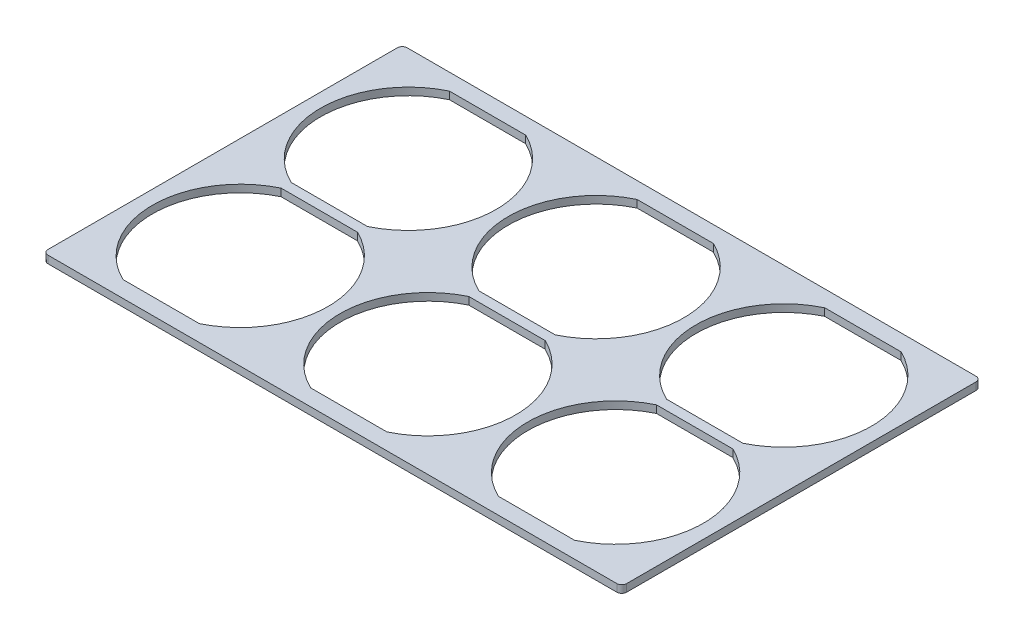
from build123d import *

# Parameters (mm, degrees)
BOSS_EXTRUDE1_DEPTH = 4.7752


with BuildPart() as part:
    # Sketch1 → Boss-Extrude1 (new body)
    with BuildSketch(Plane(origin=(0, 0, 0), x_dir=(1, 0, 0), z_dir=(0, 1, 0))):
        with BuildLine():
            Line((-180.975, 114.3), (180.975, 114.3))
            ThreePointArc((180.975, 114.3), (183.22006403, 113.37006403), (184.15, 111.125))
            Line((184.15, 111.125), (184.15, -111.125))
            ThreePointArc((184.15, -111.125), (183.22006403, -113.37006403), (180.975, -114.3))
            Line((180.975, -114.3), (-180.975, -114.3))
            ThreePointArc((-180.975, -114.3), (-183.22006403, -113.37006403), (-184.15, -111.125))
            Line((-184.15, -111.125), (-184.15, 111.125))
            ThreePointArc((-184.15, 111.125), (-183.22006403, 113.37006403), (-180.975, 114.3))
        make_face()
        with BuildLine():
            Line((-24.3078, -3.1623), (24.3078, -3.1623))
            ThreePointArc((24.3078, -3.1623), (55.879209158, -53.5178), (24.3078, -103.8733))
            Line((24.3078, -103.8733), (-24.3078, -103.8733))
            ThreePointArc((-24.3078, -103.8733), (-55.879209158, -53.5178), (-24.3078, -3.1623))
        make_face(mode=Mode.SUBTRACT)
        with BuildLine():
            Line((95.136490842, -3.1623), (143.752090842, -3.1623))
            ThreePointArc((143.752090842, -3.1623), (175.3235, -53.5178), (143.752090842, -103.8733))
            Line((143.752090842, -103.8733), (95.136490842, -103.8733))
            ThreePointArc((95.136490842, -103.8733), (63.565081684, -53.5178), (95.136490842, -3.1623))
        make_face(mode=Mode.SUBTRACT)
        with BuildLine():
            Line((-143.752090842, -3.1623), (-95.136490842, -3.1623))
            ThreePointArc((-95.136490842, -3.1623), (-63.565081684, -53.5178), (-95.136490842, -103.8733))
            Line((-95.136490842, -103.8733), (-143.752090842, -103.8733))
            ThreePointArc((-143.752090842, -103.8733), (-175.3235, -53.5178), (-143.752090842, -3.1623))
        make_face(mode=Mode.SUBTRACT)
        with BuildLine():
            Line((-24.3078, 103.8733), (24.3078, 103.8733))
            ThreePointArc((24.3078, 103.8733), (55.879209158, 53.5178), (24.3078, 3.1623))
            Line((24.3078, 3.1623), (-24.3078, 3.1623))
            ThreePointArc((-24.3078, 3.1623), (-55.879209158, 53.5178), (-24.3078, 103.8733))
        make_face(mode=Mode.SUBTRACT)
        with BuildLine():
            Line((-143.752090842, 103.8733), (-95.136490842, 103.8733))
            ThreePointArc((-95.136490842, 103.8733), (-63.565081684, 53.5178), (-95.136490842, 3.1623))
            Line((-95.136490842, 3.1623), (-143.752090842, 3.1623))
            ThreePointArc((-143.752090842, 3.1623), (-175.3235, 53.5178), (-143.752090842, 103.8733))
        make_face(mode=Mode.SUBTRACT)
        with BuildLine():
            Line((95.136490842, 103.8733), (143.752090842, 103.8733))
            ThreePointArc((143.752090842, 103.8733), (175.3235, 53.5178), (143.752090842, 3.1623))
            Line((143.752090842, 3.1623), (95.136490842, 3.1623))
            ThreePointArc((95.136490842, 3.1623), (63.565081684, 53.5178), (95.136490842, 103.8733))
        make_face(mode=Mode.SUBTRACT)
    extrude(amount=BOSS_EXTRUDE1_DEPTH)


solid = part.part
